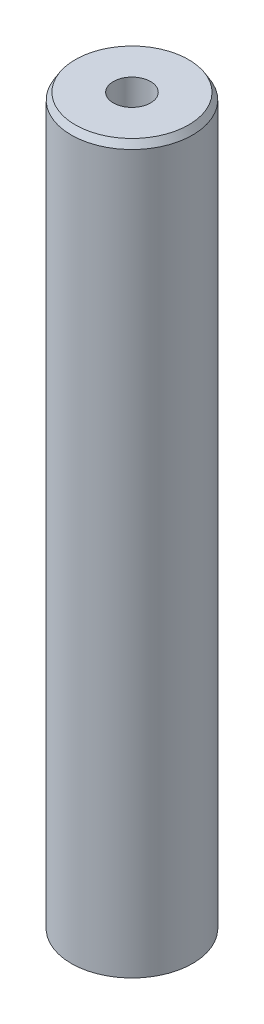
from build123d import *
from OCP.BRepFilletAPI import BRepFilletAPI_MakeChamfer

# Parameters (mm, degrees)
SKETCH1_R           = 50
BOSS_EXTRUDE1_DEPTH = 600
SKETCH2_R           = 15.332622996
CUT_EXTRUDE1_DEPTH  = 605.15229868
CHAMFER1_SIZE       = 5.542021655
CHAMFER1_SIZE2      = 3.335878229


with BuildPart() as part:
    # Sketch1 → Boss-Extrude1 (new body)
    with BuildSketch(Plane(origin=(0, 0, 0), x_dir=(1, 0, 0), z_dir=(0, 1, 0))):
        Circle(SKETCH1_R)
    extrude(amount=BOSS_EXTRUDE1_DEPTH)

    # Sketch2 → Cut-Extrude1 (cut, through all)
    with BuildSketch(Plane(origin=(0, 0, 0), x_dir=(1, 0, 0), z_dir=(0, 1, 0))):
        Circle(SKETCH2_R)
    extrude(amount=CUT_EXTRUDE1_DEPTH, mode=Mode.SUBTRACT)

    # Chamfer1: one chamfer whose edges measure the first distance from different faces: ONE call of the kernel's chamfer builder (chamfer() names one face for all edges)
    chamfer1_edges_1 = [part.edges().sort_by_distance(p)[0] for p in [
        (-50, 600, 0),
    ]]
    chamfer1_side_1 = [part.faces().sort_by_distance(p)[0] for p in [
        (-50, 300, 0),
    ]]
    chamfer1_edges_2 = [part.edges().sort_by_distance(p)[0] for p in [
        (-50, 0, 0),
    ]]
    chamfer1_side_2 = [part.faces().sort_by_distance(p)[0] for p in [
        (-48.585786438, 0, 0),
    ]]
    chamfer1 = BRepFilletAPI_MakeChamfer(part.part.solid().wrapped)
    for e in chamfer1_edges_1:
        chamfer1.Add(CHAMFER1_SIZE, CHAMFER1_SIZE2, e.wrapped, chamfer1_side_1[0].wrapped)  # the first distance lies on this face
    for e in chamfer1_edges_2:
        chamfer1.Add(CHAMFER1_SIZE, CHAMFER1_SIZE2, e.wrapped, chamfer1_side_2[0].wrapped)  # the first distance lies on this face
    add(Compound.cast(chamfer1.Shape()), mode=Mode.REPLACE)


solid = part.part
